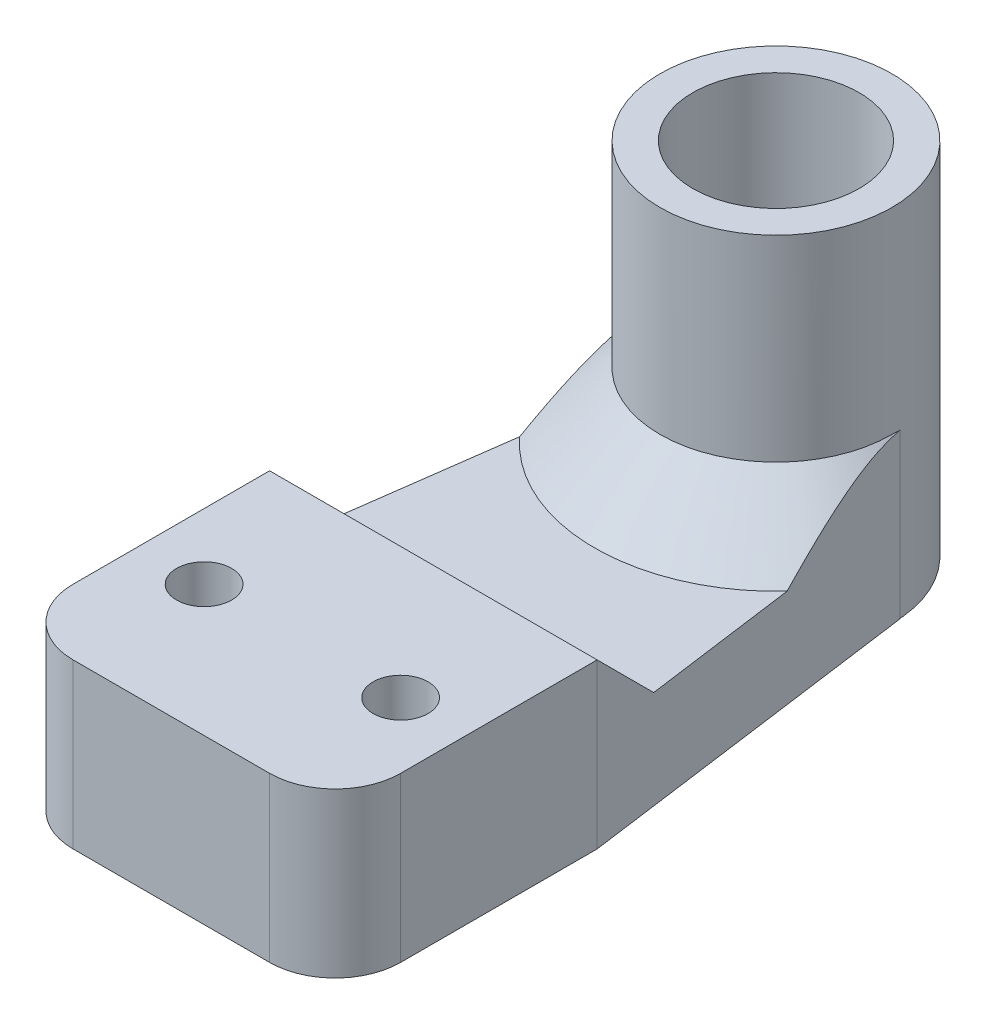
from build123d import *

# Parameters (mm, degrees)
SKETCH1_W           = 25
SKETCH1_H           = 20
SKETCH1_R           = 2.1
SKETCH1_R_2         = 8.85
SKETCH1_R_3         = 6.35
BOSS_EXTRUDE1_DEPTH = 7.5
BOSS_EXTRUDE2_START = 5
SKETCH1_3_W         = 25
SKETCH1_3_H         = 20
SKETCH1_3_R         = 2.1
BOSS_EXTRUDE2_DEPTH = 5
BOSS_EXTRUDE3_START = 20
SKETCH1_4_R         = 8.85
SKETCH1_4_R_2       = 6.35
BOSS_EXTRUDE3_DEPTH = 20
CHAMFER1_DEPTH      = 5
CHAMFER1_START      = 10.606601718
CHAMFER1_3_DEPTH    = 8.337218533
CHAMFER1_START_2    = 7.071067812
CHAMFER1_4_DEPTH    = 3.535533906
FILLET1_R           = 5


with BuildPart() as part:
    # Sketch1 → Boss-Extrude1 (new body)
    # profile 1 of 6: a face of its own
    with BuildSketch(Plane(origin=(0, 0, 0), x_dir=(1, 0, 0), z_dir=(0, 1, 0))):
        Rectangle(SKETCH1_W, SKETCH1_H)
        with Locations(Location((7.5, 0, 0), (0, 0, 270))):
            Circle(SKETCH1_R, mode=Mode.SUBTRACT)
        with Locations(Location((-7.5, 0, 0), (0, 0, 270))):
            Circle(SKETCH1_R, mode=Mode.SUBTRACT)
    # profile 2 of 6: a face of its own
    with BuildSketch(Plane(origin=(0, 0, 0), x_dir=(1, 0, 0), z_dir=(0, 1, 0))):
        with Locations((0, 36.15)):
            Circle(SKETCH1_R_2)
        with Locations((0, 36.15)):
            Circle(SKETCH1_R_3, mode=Mode.SUBTRACT)
    # profile 3 of 6: a face of its own
    with BuildSketch(Plane(origin=(0, 0, 0), x_dir=(1, 0, 0), z_dir=(0, 1, 0))):
        with BuildLine():
            Line((-8.85, 36.15), (-8.85, 10))
            Line((-8.85, 10), (8.85, 10))
            Line((8.85, 10), (8.85, 36.15))
            ThreePointArc((8.85, 36.15), (0, 27.3), (-8.85, 36.15))
        make_face()
    # profile 4 of 6: a face of its own
    with BuildSketch(Plane(origin=(0, 0, 0), x_dir=(1, 0, 0), z_dir=(0, 1, 0))):
        with Locations((0, 36.15)):
            Circle(SKETCH1_R_3)
    # profile 5 of 6: a face of its own
    with BuildSketch(Plane(origin=(0, 0, 0), x_dir=(1, 0, 0), z_dir=(0, 1, 0))):
        Polygon((-8.85, 36.75097877), (-12.5, 10), (-8.85, 10), (-8.85, 36.15), align=None)
    # profile 6 of 6: a face of its own
    with BuildSketch(Plane(origin=(0, 0, 0), x_dir=(1, 0, 0), z_dir=(0, 1, 0))):
        Polygon((8.85, 36.15), (8.85, 10), (12.5, 10), (8.85, 36.75097877), align=None)
    extrude(amount=-BOSS_EXTRUDE1_DEPTH)

    # Sketch1<3> → Boss-Extrude2 (add)
    with BuildSketch(Plane(origin=(0, 0, 0), x_dir=(1, 0, 0), z_dir=(0, 1, 0)).offset(BOSS_EXTRUDE2_START)):
        Rectangle(SKETCH1_3_W, SKETCH1_3_H)
        with Locations(Location((7.5, 0, 0), (0, 0, 270))):
            Circle(SKETCH1_3_R, mode=Mode.SUBTRACT)
        with Locations(Location((-7.5, 0, 0), (0, 0, 270))):
            Circle(SKETCH1_3_R, mode=Mode.SUBTRACT)
    extrude(amount=-BOSS_EXTRUDE2_DEPTH)

    # Sketch1<4> → Boss-Extrude3 (add)
    with BuildSketch(Plane(origin=(0, 0, 0), x_dir=(1, 0, 0), z_dir=(0, 1, 0)).offset(BOSS_EXTRUDE3_START)):
        with Locations(Location((0, 36.15, 0), (0, 0, 270))):
            Circle(SKETCH1_4_R)
        with Locations(Location((0, 36.15, 0), (0, 0, 270))):
            Circle(SKETCH1_4_R_2, mode=Mode.SUBTRACT)
    extrude(amount=-BOSS_EXTRUDE3_DEPTH)

    # Chamfer1: read off the stored shape, not the designer's step
    # Chamfer1 outline → Chamfer1 (add)
    with BuildSketch(Plane(origin=(0, 0, 0), x_dir=(1, 0, 0), z_dir=(0, 1, 0))):
        with BuildLine():
            Line((8.85, 36.75097877), (8.85, 36.15))
            ThreePointArc((8.85, 36.15), (0, 27.3), (-8.85, 36.15))
            Line((-8.85, 36.15), (-8.85, 36.75097877))
            Line((-8.85, 36.75097877), (-12.5, 10))
            Line((-12.5, 10), (12.5, 10))
            Line((12.5, 10), (8.85, 36.75097877))
        make_face()
    extrude(amount=CHAMFER1_DEPTH)

    # Chamfer1 2 outline → Chamfer1 2 (revolve, cut)
    with BuildSketch(Plane.XY.offset(-36.15)):
        Polygon((8.85, 5), (13.85, 0), (24.227721121, 0), (24.227721121, 5), align=None)
    revolve(axis=Axis((0, 0, -36.15), (0, 1, 0)), mode=Mode.SUBTRACT)

    # Chamfer1 3 outline → Chamfer1 3 (cut)
    with BuildSketch(Plane(origin=(0, 0, 0), x_dir=(1, 0, 0), z_dir=(0, 0.7071067811865516, -0.7071067811865436)).offset(CHAMFER1_START)):
        Polygon((11.817781971, 10.606601718), (-11.817781971, 10.606601718), (-12.5, 3.535533906), (12.5, 3.535533906), align=None)
    extrude(amount=CHAMFER1_3_DEPTH, mode=Mode.SUBTRACT)

    # Chamfer1 4 outline → Chamfer1 4 (add)
    with BuildSketch(Plane(origin=(0, 0, 0), x_dir=(1, 0, 0), z_dir=(0, 0.7071067811865516, -0.7071067811865436)).offset(CHAMFER1_START_2)):
        Polygon((11.817781971, 10.606601718), (-11.817781971, 10.606601718), (-12.5, 3.535533906), (12.5, 3.535533906), align=None)
    extrude(amount=CHAMFER1_4_DEPTH)

    # Fillet1
    fillet1_edges = [part.edges().sort_by_distance(p)[0] for p in [
        (12.5, -1.25, 10),
        (-12.5, -1.25, 10),
    ]]
    fillet(fillet1_edges, radius=FILLET1_R)


solid = part.part
